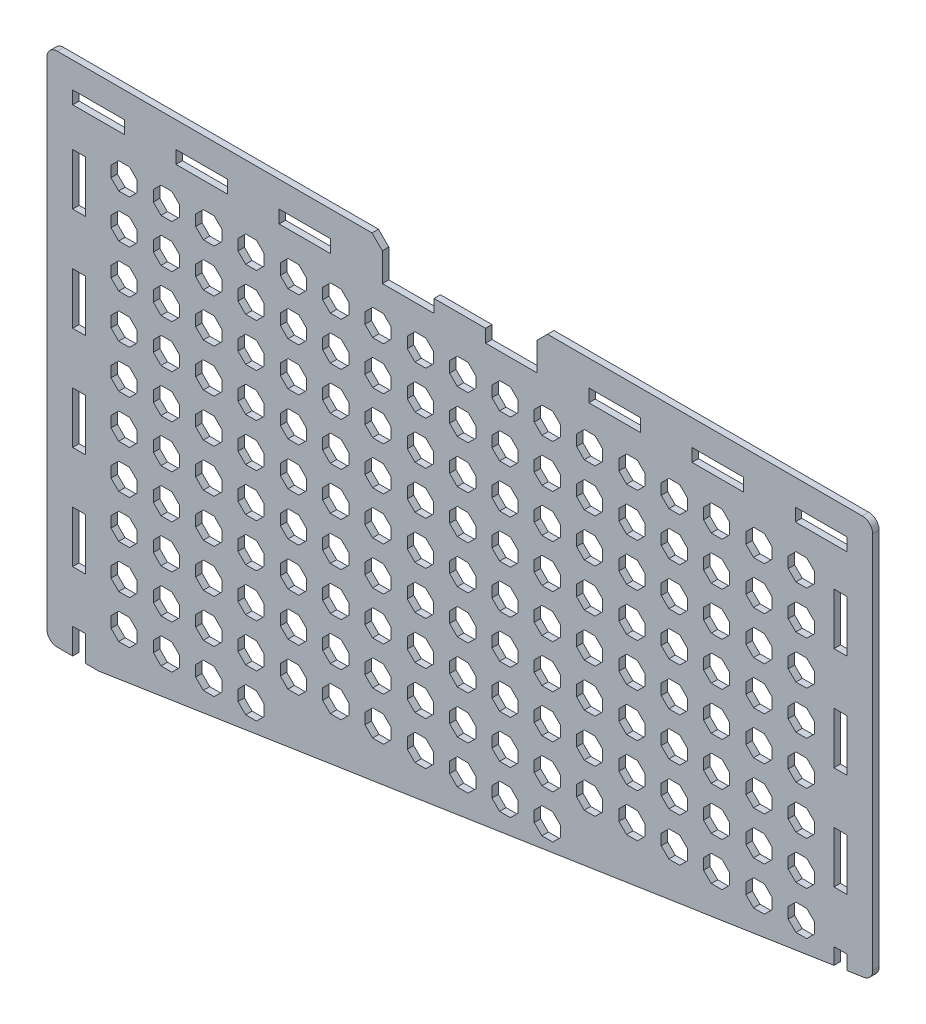
from build123d import *

# Parameters (mm, degrees)
SKETCH1_W            = 203.2
SKETCH1_H            = 127
BOSS_EXTRUDE1_DEPTH  = 1.5875
CUT_EXTRUDE1_DEPTH   = 240.62837928
SKETCH3_W            = 12.7
SKETCH3_H            = 3.175
CUT_EXTRUDE2_DEPTH   = 240.62837928
LPATTERN1_COUNT      = 8
LPATTERN1_PITCH      = 25.4
SKETCH4_W            = 3.175
SKETCH4_H            = 12.7
CUT_EXTRUDE3_DEPTH   = 240.62837928
LPATTERN2_COUNT      = 5
LPATTERN2_PITCH      = 25.4
SKETCH5_W            = 3.175
SKETCH5_H            = 12.7
CUT_EXTRUDE4_DEPTH   = 240.62837928
LPATTERN3_COUNT      = 4
LPATTERN3_PITCH      = 25.4
FILLET1_R            = 2.54
SKETCH8_W            = 38.1
SKETCH8_H            = 6.35
CUT_EXTRUDE5_DEPTH   = 240.62837928
CHAMFER1_SIZE        = 2.54
CUT_EXTRUDE6_DEPTH   = 240.62837928
LPATTERN5_COUNT      = 17
LPATTERN5_PITCH      = 10.414
LPATTERN5_COUNT_DIR2 = 10
LPATTERN5_PITCH_DIR2 = 10.668


with BuildPart() as part:
    # Sketch1 → Boss-Extrude1 (new body)
    with BuildSketch(Plane.XY):
        with Locations((101.6, -63.5)):
            Rectangle(SKETCH1_W, SKETCH1_H)
    extrude(amount=BOSS_EXTRUDE1_DEPTH)

    # Sketch2 → Cut-Extrude1 (cut, through all)
    with BuildSketch(Plane.XY.offset(1.5875)):
        Polygon((12.7, -127), (203.2, -127), (203.2, -97.79), align=None)
    extrude(amount=-CUT_EXTRUDE1_DEPTH, mode=Mode.SUBTRACT)

    # Sketch3 → Cut-Extrude2 (cut, through all)
    with BuildSketch(Plane.XY.offset(1.5875)):
        with Locations((12.7, -7.9375)):
            Rectangle(SKETCH3_W, SKETCH3_H)
    cut_extrude2 = extrude(amount=-CUT_EXTRUDE2_DEPTH, mode=Mode.SUBTRACT)

    # LPattern1: Cut-Extrude2 ×8
    with Locations(*[(i * LPATTERN1_PITCH, 0, 0) for i in range(1, LPATTERN1_COUNT)]):
        add(cut_extrude2, mode=Mode.SUBTRACT)

    # Sketch4 → Cut-Extrude3 (cut, through all)
    with BuildSketch(Plane.XY.offset(1.5875)):
        with Locations((7.9375, -25.4)):
            Rectangle(SKETCH4_W, SKETCH4_H)
    cut_extrude3 = extrude(amount=-CUT_EXTRUDE3_DEPTH, mode=Mode.SUBTRACT)

    # LPattern2: Cut-Extrude3 ×5
    with Locations(*[(0, -i * LPATTERN2_PITCH, 0) for i in range(1, LPATTERN2_COUNT)]):
        add(cut_extrude3, mode=Mode.SUBTRACT)

    # Sketch5 → Cut-Extrude4 (cut, through all)
    with BuildSketch(Plane.XY.offset(1.5875)):
        with Locations((195.2625, -25.4)):
            Rectangle(SKETCH5_W, SKETCH5_H)
    cut_extrude4 = extrude(amount=-CUT_EXTRUDE4_DEPTH, mode=Mode.SUBTRACT)

    # LPattern3: Cut-Extrude4 ×4
    with Locations(*[(0, -i * LPATTERN3_PITCH, 0) for i in range(1, LPATTERN3_COUNT)]):
        add(cut_extrude4, mode=Mode.SUBTRACT)

    # Fillet1
    fillet1_edges = [part.edges().sort_by_distance(p)[0] for p in [
        (203.2, -97.79, 0.79375),
        (0, 0, 0.79375),
        (203.2, 0, 0.79375),
        (0, -127, 0.79375),
    ]]
    fillet(fillet1_edges, radius=FILLET1_R)

    # Sketch8 → Cut-Extrude5 (cut, through all)
    with BuildSketch(Plane.XY.offset(1.5875)):
        with Locations((101.6, -3.175)):
            Rectangle(SKETCH8_W, SKETCH8_H)
    extrude(amount=-CUT_EXTRUDE5_DEPTH, mode=Mode.SUBTRACT)

    # Chamfer1
    chamfer1_edges = [part.edges().sort_by_distance(p)[0] for p in [
        (82.55, 0, 0.79375),
        (120.65, 0, 0.79375),
    ]]
    chamfer(chamfer1_edges, length=CHAMFER1_SIZE)

    # Sketch9 → Cut-Extrude6 (cut, through all)
    with BuildSketch(Plane.XY.offset(1.5875)):
        Polygon((15.784004156, -20.336857941), (17.669857941, -22.222711727), (20.336857941, -22.222711727), (22.222711727, -20.336857941), (22.222711727, -17.669857941), (20.336857941, -15.784004156), (17.669857941, -15.784004156), (15.784004156, -17.669857941), align=None)
    cut_extrude6 = extrude(amount=-CUT_EXTRUDE6_DEPTH, mode=Mode.SUBTRACT)

    # LPattern5: Cut-Extrude6 17 × 10, 19 skipped
    with Locations(*[(i * LPATTERN5_PITCH, -j * LPATTERN5_PITCH_DIR2, 0) for i in range(LPATTERN5_COUNT) for j in range(LPATTERN5_COUNT_DIR2) if (i, j) not in ((0, 0), (4, 9), (5, 9), (6, 9), (7, 9), (8, 9), (9, 9), (10, 9), (11, 8), (11, 9), (12, 8), (12, 9), (13, 8), (13, 9), (14, 8), (14, 9), (15, 8), (15, 9), (16, 8), (16, 9))]):
        add(cut_extrude6, mode=Mode.SUBTRACT)


solid = part.part
